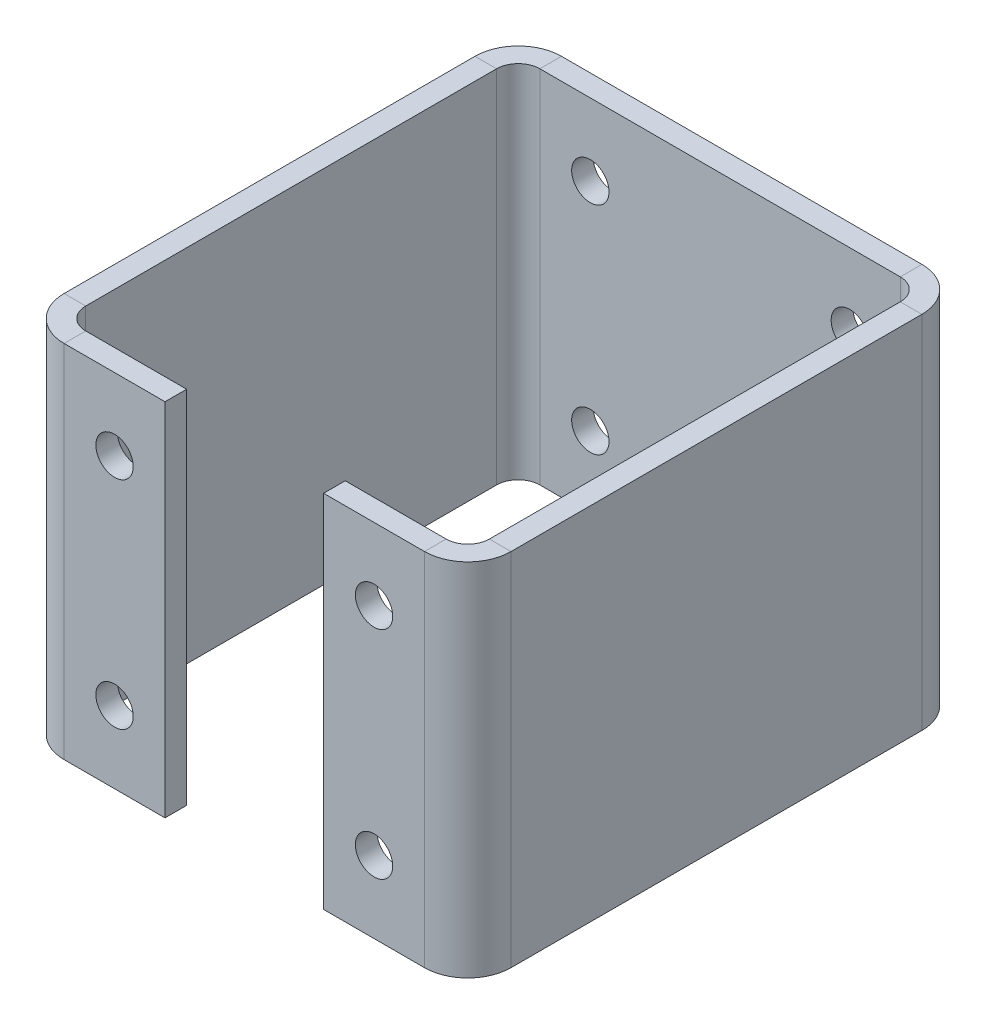
from build123d import *

# Parameters (mm, degrees)
SKETCH1_W                  = 50
SKETCH1_H                  = 50
BASE_FLANGE1_DEPTH         = 3
EDGE_FLANGE1_DEPTH         = 50
EDGE_FLANGE2_DEPTH         = 50
EDGE_FLANGE3_DEPTH         = 50
EDGE_FLANGE4_DEPTH         = 50
F_6_0_204_DIAMETER_SLOT1_D = 5.1816


# Sheet-metal steps are written as plain solids
with BuildPart() as part:
    # Sketch1 → Base-Flange1 (new body)
    with BuildSketch(Plane.XY):
        Rectangle(SKETCH1_W, SKETCH1_H)
    extrude(amount=-BASE_FLANGE1_DEPTH)

    # Edge-Flange1 section (across the edge) → Edge-Flange1 (add)
    with BuildSketch(Plane(origin=(28, -25, 0), x_dir=(-1, 0, 0), z_dir=(0, 1, 0))):
        with BuildLine():
            Line((-3, 3), (-3, 60))
            Line((-3, 60), (0, 60))
            Line((0, 60), (0, 3))
            ThreePointArc((0, 3), (0.878679656, 0.878679656), (3, 0))
            Line((3, 0), (3, -3))
            ThreePointArc((3, -3), (-1.242640687, -1.242640687), (-3, 3))
        make_face()
    extrude(amount=EDGE_FLANGE1_DEPTH)

    # Edge-Flange2 section (across the edge) → Edge-Flange2 (add)
    with BuildSketch(Plane(origin=(-28, 25, 0), x_dir=(1, 0, 0), z_dir=(0, -1, 0))):
        with BuildLine():
            Line((-3, 3), (-3, 60))
            Line((-3, 60), (0, 60))
            Line((0, 60), (0, 3))
            ThreePointArc((0, 3), (0.878679656, 0.878679656), (3, 0))
            Line((3, 0), (3, -3))
            ThreePointArc((3, -3), (-1.242640687, -1.242640687), (-3, 3))
        make_face()
    extrude(amount=EDGE_FLANGE2_DEPTH)

    # Edge-Flange3 section (across the edge) → Edge-Flange3 (add)
    with BuildSketch(Plane(origin=(-28, 25, 63), x_dir=(0, 0, -1), z_dir=(0, -1, 0))):
        with BuildLine():
            Line((-3, 3), (-3, 17))
            Line((-3, 17), (0, 17))
            Line((0, 17), (0, 3))
            ThreePointArc((0, 3), (0.878679656, 0.878679656), (3, 0))
            Line((3, 0), (3, -3))
            ThreePointArc((3, -3), (-1.242640687, -1.242640687), (-3, 3))
        make_face()
    extrude(amount=EDGE_FLANGE3_DEPTH)

    # Edge-Flange4 section (across the edge) → Edge-Flange4 (add)
    with BuildSketch(Plane(origin=(28, -25, 63), x_dir=(0, 0, -1), z_dir=(0, 1, 0))):
        with BuildLine():
            Line((-3, 3), (-3, 17))
            Line((-3, 17), (0, 17))
            Line((0, 17), (0, 3))
            ThreePointArc((0, 3), (0.878679656, 0.878679656), (3, 0))
            Line((3, 0), (3, -3))
            ThreePointArc((3, -3), (-1.242640687, -1.242640687), (-3, 3))
        make_face()
    extrude(amount=EDGE_FLANGE4_DEPTH)

    # #6 (0.204) Diameter Slot1 (through all)
    with Locations(Plane.XY.offset(66)):
        with Locations((-18, 15), (-18, -15), (18, 15), (18, -15)):
            Hole(F_6_0_204_DIAMETER_SLOT1_D / 2)


solid = part.part
